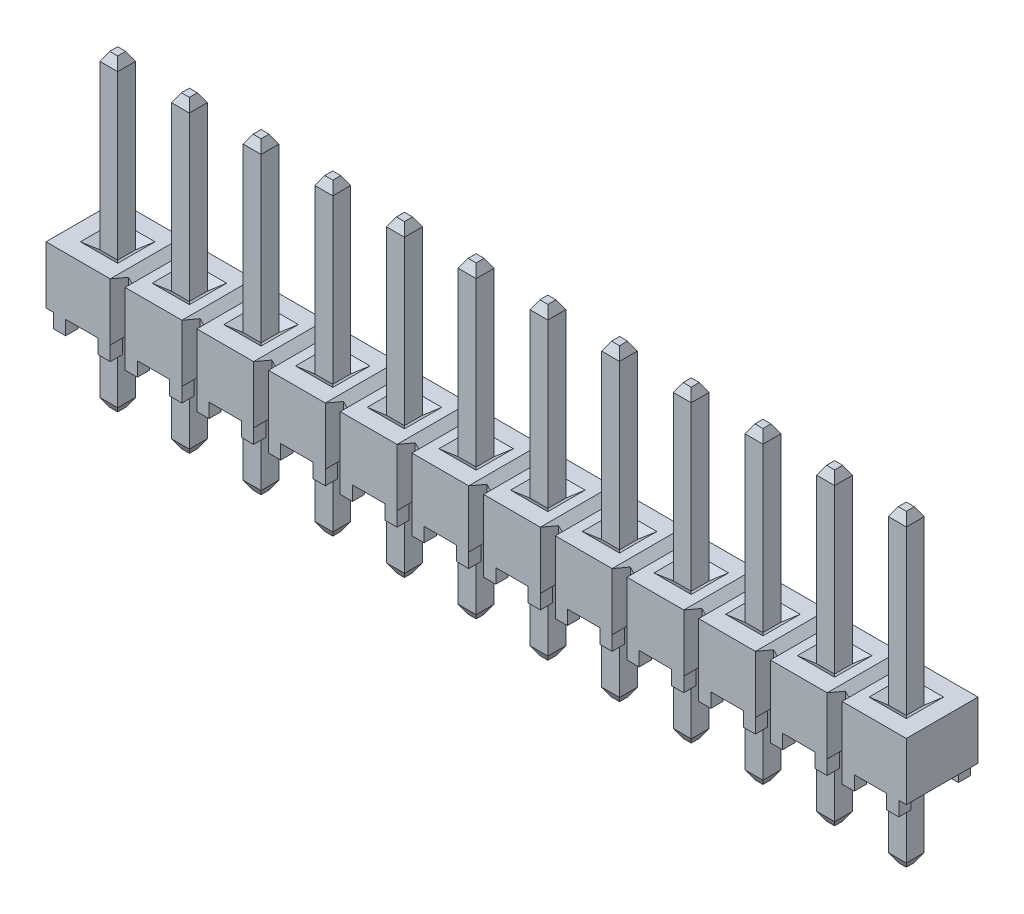
from build123d import *
from OCP.BRepFilletAPI import BRepFilletAPI_MakeChamfer

# Parameters (mm, degrees)
MAIN_BODY_DEPTH                          = 1.27
SKETCH4_W                                = 0.508
SKETCH4_H                                = 1.6764
BASE_CUT_DEPTH                           = 2.54
MAIN_BODY_PATTERN_COUNT                  = 12
MAIN_BODY_PATTERN_PITCH                  = 2.54
SKETCH19_W                               = 0.6096
SKETCH19_H                               = 0.6096
PIN_CUT_DEPTH                            = 29.083947372
PIN_CHAMFER_SIZE                         = 0.254
PIN_CHAMFER_SIZE2                        = 0.3556
PIN_PATTERN_COUNT                        = 12
PIN_PATTERN_PITCH                        = 2.54
PIN_CHAMFER_OF_PIN_PATTERN_SIZE          = 0.254
PIN_CHAMFER_OF_PIN_PATTERN_SIZE2         = 0.3556
SLOT_CUT_1_DEPTH                         = 29.083947372
SLOT_CUT_2_DEPTH                         = 2.54
SLOT_PATTERN_COUNT                       = 11
SLOT_PATTERN_PITCH                       = 2.54
SKETCH9_W                                = 0.635
SKETCH9_H                                = 10.922
STRAIGHT_LEAD_DEPTH                      = 0.3175
LEAD_CHAMFER_SIZE                        = 0.17526
LEAD_CHAMFER_SIZE2                       = 0.3048
STRAIGHT_L_PATTERN_COUNT                 = 12
STRAIGHT_L_PATTERN_PITCH                 = 2.54
LEAD_CHAMFER_OF_STRAIGHT_L_PATTERN_SIZE  = 0.17526
LEAD_CHAMFER_OF_STRAIGHT_L_PATTERN_SIZE2 = 0.3048


with BuildPart() as part:
    # Sketch3 → Main Body (new, symmetric)
    with BuildSketch(Plane.XY):
        Polygon((0, 0.508), (0.26416, 0.508), (0.26416, 0), (0.69596, 0), (0.69596, 0.508), (1.84404, 0.508), (1.84404, 0), (2.27584, 0), (2.27584, 0.508), (2.54, 0.508), (2.54, 2.54), (0, 2.54), align=None)
    main_body = extrude(amount=MAIN_BODY_DEPTH, both=True)

    # Sketch4 → Base Cut (cut)
    with BuildSketch(Plane(origin=(2.54, 2.54, 0), x_dir=(0, -1, 0), z_dir=(-1, 0, 0))):
        with Locations((2.286, 0)):
            Rectangle(SKETCH4_W, SKETCH4_H)
    base_cut = extrude(amount=BASE_CUT_DEPTH, mode=Mode.SUBTRACT)

    # Main Body Pattern: Main Body, Base Cut ×12
    with Locations(*[(-i * MAIN_BODY_PATTERN_PITCH, 0, 0) for i in range(1, MAIN_BODY_PATTERN_COUNT)]):
        add(main_body)
        add(base_cut, mode=Mode.SUBTRACT)

    # Sketch19 → Pin Cut (cut, through all)
    with BuildSketch(Plane(origin=(0, 2.54, 0), x_dir=(-1, 0, 0), z_dir=(0, 1, 0))):
        with Locations((-1.27, 0)):
            Rectangle(SKETCH19_W, SKETCH19_H)
    pin_cut = extrude(amount=-PIN_CUT_DEPTH, mode=Mode.SUBTRACT)

    # Pin Chamfer: one chamfer whose edges measure the first distance from different faces: ONE call of the kernel's chamfer builder (chamfer() names one face for all edges)
    pin_chamfer_edges_1 = [part.edges().sort_by_distance(p)[0] for p in [
        (1.27, 0.508, -0.3048),
        (1.27, 2.54, -0.3048),
    ]]
    pin_chamfer_side_1 = [part.faces().sort_by_distance(p)[0] for p in [
        (1.27, 1.524, -0.3048),
    ]]
    pin_chamfer_edges_2 = [part.edges().sort_by_distance(p)[0] for p in [
        (0.9652, 0.508, 0),
        (0.9652, 2.54, 0),
    ]]
    pin_chamfer_side_2 = [part.faces().sort_by_distance(p)[0] for p in [
        (0.9652, 1.524, 0),
    ]]
    pin_chamfer_edges_3 = [part.edges().sort_by_distance(p)[0] for p in [
        (1.27, 0.508, 0.3048),
        (1.27, 2.54, 0.3048),
    ]]
    pin_chamfer_side_3 = [part.faces().sort_by_distance(p)[0] for p in [
        (1.27, 1.524, 0.3048),
    ]]
    pin_chamfer_edges_4 = [part.edges().sort_by_distance(p)[0] for p in [
        (1.5748, 0.508, 0),
        (1.5748, 2.54, 0),
    ]]
    pin_chamfer_side_4 = [part.faces().sort_by_distance(p)[0] for p in [
        (1.5748, 1.524, 0),
    ]]
    pin_chamfer = BRepFilletAPI_MakeChamfer(part.part.solid().wrapped)
    for e in pin_chamfer_edges_1:
        pin_chamfer.Add(PIN_CHAMFER_SIZE, PIN_CHAMFER_SIZE2, e.wrapped, pin_chamfer_side_1[0].wrapped)  # the first distance lies on this face
    for e in pin_chamfer_edges_2:
        pin_chamfer.Add(PIN_CHAMFER_SIZE, PIN_CHAMFER_SIZE2, e.wrapped, pin_chamfer_side_2[0].wrapped)  # the first distance lies on this face
    for e in pin_chamfer_edges_3:
        pin_chamfer.Add(PIN_CHAMFER_SIZE, PIN_CHAMFER_SIZE2, e.wrapped, pin_chamfer_side_3[0].wrapped)  # the first distance lies on this face
    for e in pin_chamfer_edges_4:
        pin_chamfer.Add(PIN_CHAMFER_SIZE, PIN_CHAMFER_SIZE2, e.wrapped, pin_chamfer_side_4[0].wrapped)  # the first distance lies on this face
    add(Compound.cast(pin_chamfer.Shape()), mode=Mode.REPLACE)

    # Pin Pattern: Pin Cut ×12
    with Locations(*[(-i * PIN_PATTERN_PITCH, 0, 0) for i in range(1, PIN_PATTERN_COUNT)]):
        add(pin_cut, mode=Mode.SUBTRACT)

    # Pin Chamfer of Pin Pattern: one chamfer whose edges measure the first distance from different faces: ONE call of the kernel's chamfer builder (chamfer() names one face for all edges)
    pin_chamfer_of_pin_pattern_edges_1 = [part.edges().sort_by_distance(p)[0] for p in [
        (-1.27, 0.508, -0.3048),
        (-1.27, 2.54, -0.3048),
    ]]
    pin_chamfer_of_pin_pattern_side_1 = [part.faces().sort_by_distance(p)[0] for p in [
        (-1.27, 1.524, -0.3048),
    ]]
    pin_chamfer_of_pin_pattern_edges_2 = [part.edges().sort_by_distance(p)[0] for p in [
        (-1.5748, 0.508, 0),
        (-1.5748, 2.54, 0),
    ]]
    pin_chamfer_of_pin_pattern_side_2 = [part.faces().sort_by_distance(p)[0] for p in [
        (-1.5748, 1.524, 0),
    ]]
    pin_chamfer_of_pin_pattern_edges_3 = [part.edges().sort_by_distance(p)[0] for p in [
        (-1.27, 0.508, 0.3048),
        (-1.27, 2.54, 0.3048),
    ]]
    pin_chamfer_of_pin_pattern_side_3 = [part.faces().sort_by_distance(p)[0] for p in [
        (-1.27, 1.524, 0.3048),
    ]]
    pin_chamfer_of_pin_pattern_edges_4 = [part.edges().sort_by_distance(p)[0] for p in [
        (-0.9652, 0.508, 0),
        (-0.9652, 2.54, 0),
    ]]
    pin_chamfer_of_pin_pattern_side_4 = [part.faces().sort_by_distance(p)[0] for p in [
        (-0.9652, 1.524, 0),
    ]]
    pin_chamfer_of_pin_pattern_edges_5 = [part.edges().sort_by_distance(p)[0] for p in [
        (-3.81, 0.508, -0.3048),
        (-3.81, 2.54, -0.3048),
    ]]
    pin_chamfer_of_pin_pattern_side_5 = [part.faces().sort_by_distance(p)[0] for p in [
        (-3.81, 1.524, -0.3048),
    ]]
    pin_chamfer_of_pin_pattern_edges_6 = [part.edges().sort_by_distance(p)[0] for p in [
        (-4.1148, 0.508, 0),
        (-4.1148, 2.54, 0),
    ]]
    pin_chamfer_of_pin_pattern_side_6 = [part.faces().sort_by_distance(p)[0] for p in [
        (-4.1148, 1.524, 0),
    ]]
    pin_chamfer_of_pin_pattern_edges_7 = [part.edges().sort_by_distance(p)[0] for p in [
        (-3.81, 0.508, 0.3048),
        (-3.81, 2.54, 0.3048),
    ]]
    pin_chamfer_of_pin_pattern_side_7 = [part.faces().sort_by_distance(p)[0] for p in [
        (-3.81, 1.524, 0.3048),
    ]]
    pin_chamfer_of_pin_pattern_edges_8 = [part.edges().sort_by_distance(p)[0] for p in [
        (-3.5052, 0.508, 0),
        (-3.5052, 2.54, 0),
    ]]
    pin_chamfer_of_pin_pattern_side_8 = [part.faces().sort_by_distance(p)[0] for p in [
        (-3.5052, 1.524, 0),
    ]]
    pin_chamfer_of_pin_pattern_edges_9 = [part.edges().sort_by_distance(p)[0] for p in [
        (-6.35, 0.508, -0.3048),
        (-6.35, 2.54, -0.3048),
    ]]
    pin_chamfer_of_pin_pattern_side_9 = [part.faces().sort_by_distance(p)[0] for p in [
        (-6.35, 1.524, -0.3048),
    ]]
    pin_chamfer_of_pin_pattern_edges_10 = [part.edges().sort_by_distance(p)[0] for p in [
        (-6.6548, 0.508, 0),
        (-6.6548, 2.54, 0),
    ]]
    pin_chamfer_of_pin_pattern_side_10 = [part.faces().sort_by_distance(p)[0] for p in [
        (-6.6548, 1.524, 0),
    ]]
    pin_chamfer_of_pin_pattern_edges_11 = [part.edges().sort_by_distance(p)[0] for p in [
        (-6.35, 0.508, 0.3048),
        (-6.35, 2.54, 0.3048),
    ]]
    pin_chamfer_of_pin_pattern_side_11 = [part.faces().sort_by_distance(p)[0] for p in [
        (-6.35, 1.524, 0.3048),
    ]]
    pin_chamfer_of_pin_pattern_edges_12 = [part.edges().sort_by_distance(p)[0] for p in [
        (-6.0452, 0.508, 0),
        (-6.0452, 2.54, 0),
    ]]
    pin_chamfer_of_pin_pattern_side_12 = [part.faces().sort_by_distance(p)[0] for p in [
        (-6.0452, 1.524, 0),
    ]]
    pin_chamfer_of_pin_pattern_edges_13 = [part.edges().sort_by_distance(p)[0] for p in [
        (-8.89, 0.508, -0.3048),
        (-8.89, 2.54, -0.3048),
    ]]
    pin_chamfer_of_pin_pattern_side_13 = [part.faces().sort_by_distance(p)[0] for p in [
        (-8.89, 1.524, -0.3048),
    ]]
    pin_chamfer_of_pin_pattern_edges_14 = [part.edges().sort_by_distance(p)[0] for p in [
        (-9.1948, 0.508, 0),
        (-9.1948, 2.54, 0),
    ]]
    pin_chamfer_of_pin_pattern_side_14 = [part.faces().sort_by_distance(p)[0] for p in [
        (-9.1948, 1.524, 0),
    ]]
    pin_chamfer_of_pin_pattern_edges_15 = [part.edges().sort_by_distance(p)[0] for p in [
        (-8.89, 0.508, 0.3048),
        (-8.89, 2.54, 0.3048),
    ]]
    pin_chamfer_of_pin_pattern_side_15 = [part.faces().sort_by_distance(p)[0] for p in [
        (-8.89, 1.524, 0.3048),
    ]]
    pin_chamfer_of_pin_pattern_edges_16 = [part.edges().sort_by_distance(p)[0] for p in [
        (-8.5852, 0.508, 0),
        (-8.5852, 2.54, 0),
    ]]
    pin_chamfer_of_pin_pattern_side_16 = [part.faces().sort_by_distance(p)[0] for p in [
        (-8.5852, 1.524, 0),
    ]]
    pin_chamfer_of_pin_pattern_edges_17 = [part.edges().sort_by_distance(p)[0] for p in [
        (-11.43, 0.508, -0.3048),
        (-11.43, 2.54, -0.3048),
    ]]
    pin_chamfer_of_pin_pattern_side_17 = [part.faces().sort_by_distance(p)[0] for p in [
        (-11.43, 1.524, -0.3048),
    ]]
    pin_chamfer_of_pin_pattern_edges_18 = [part.edges().sort_by_distance(p)[0] for p in [
        (-11.7348, 0.508, 0),
        (-11.7348, 2.54, 0),
    ]]
    pin_chamfer_of_pin_pattern_side_18 = [part.faces().sort_by_distance(p)[0] for p in [
        (-11.7348, 1.524, 0),
    ]]
    pin_chamfer_of_pin_pattern_edges_19 = [part.edges().sort_by_distance(p)[0] for p in [
        (-11.43, 0.508, 0.3048),
        (-11.43, 2.54, 0.3048),
    ]]
    pin_chamfer_of_pin_pattern_side_19 = [part.faces().sort_by_distance(p)[0] for p in [
        (-11.43, 1.524, 0.3048),
    ]]
    pin_chamfer_of_pin_pattern_edges_20 = [part.edges().sort_by_distance(p)[0] for p in [
        (-11.1252, 0.508, 0),
        (-11.1252, 2.54, 0),
    ]]
    pin_chamfer_of_pin_pattern_side_20 = [part.faces().sort_by_distance(p)[0] for p in [
        (-11.1252, 1.524, 0),
    ]]
    pin_chamfer_of_pin_pattern_edges_21 = [part.edges().sort_by_distance(p)[0] for p in [
        (-13.97, 0.508, -0.3048),
        (-13.97, 2.54, -0.3048),
    ]]
    pin_chamfer_of_pin_pattern_side_21 = [part.faces().sort_by_distance(p)[0] for p in [
        (-13.97, 1.524, -0.3048),
    ]]
    pin_chamfer_of_pin_pattern_edges_22 = [part.edges().sort_by_distance(p)[0] for p in [
        (-14.2748, 0.508, 0),
        (-14.2748, 2.54, 0),
    ]]
    pin_chamfer_of_pin_pattern_side_22 = [part.faces().sort_by_distance(p)[0] for p in [
        (-14.2748, 1.524, 0),
    ]]
    pin_chamfer_of_pin_pattern_edges_23 = [part.edges().sort_by_distance(p)[0] for p in [
        (-13.97, 0.508, 0.3048),
        (-13.97, 2.54, 0.3048),
    ]]
    pin_chamfer_of_pin_pattern_side_23 = [part.faces().sort_by_distance(p)[0] for p in [
        (-13.97, 1.524, 0.3048),
    ]]
    pin_chamfer_of_pin_pattern_edges_24 = [part.edges().sort_by_distance(p)[0] for p in [
        (-13.6652, 0.508, 0),
        (-13.6652, 2.54, 0),
    ]]
    pin_chamfer_of_pin_pattern_side_24 = [part.faces().sort_by_distance(p)[0] for p in [
        (-13.6652, 1.524, 0),
    ]]
    pin_chamfer_of_pin_pattern_edges_25 = [part.edges().sort_by_distance(p)[0] for p in [
        (-16.51, 0.508, -0.3048),
        (-16.51, 2.54, -0.3048),
    ]]
    pin_chamfer_of_pin_pattern_side_25 = [part.faces().sort_by_distance(p)[0] for p in [
        (-16.51, 1.524, -0.3048),
    ]]
    pin_chamfer_of_pin_pattern_edges_26 = [part.edges().sort_by_distance(p)[0] for p in [
        (-16.8148, 0.508, 0),
        (-16.8148, 2.54, 0),
    ]]
    pin_chamfer_of_pin_pattern_side_26 = [part.faces().sort_by_distance(p)[0] for p in [
        (-16.8148, 1.524, 0),
    ]]
    pin_chamfer_of_pin_pattern_edges_27 = [part.edges().sort_by_distance(p)[0] for p in [
        (-16.51, 0.508, 0.3048),
        (-16.51, 2.54, 0.3048),
    ]]
    pin_chamfer_of_pin_pattern_side_27 = [part.faces().sort_by_distance(p)[0] for p in [
        (-16.51, 1.524, 0.3048),
    ]]
    pin_chamfer_of_pin_pattern_edges_28 = [part.edges().sort_by_distance(p)[0] for p in [
        (-16.2052, 0.508, 0),
        (-16.2052, 2.54, 0),
    ]]
    pin_chamfer_of_pin_pattern_side_28 = [part.faces().sort_by_distance(p)[0] for p in [
        (-16.2052, 1.524, 0),
    ]]
    pin_chamfer_of_pin_pattern_edges_29 = [part.edges().sort_by_distance(p)[0] for p in [
        (-19.05, 0.508, -0.3048),
        (-19.05, 2.54, -0.3048),
    ]]
    pin_chamfer_of_pin_pattern_side_29 = [part.faces().sort_by_distance(p)[0] for p in [
        (-19.05, 1.524, -0.3048),
    ]]
    pin_chamfer_of_pin_pattern_edges_30 = [part.edges().sort_by_distance(p)[0] for p in [
        (-19.3548, 0.508, 0),
        (-19.3548, 2.54, 0),
    ]]
    pin_chamfer_of_pin_pattern_side_30 = [part.faces().sort_by_distance(p)[0] for p in [
        (-19.3548, 1.524, 0),
    ]]
    pin_chamfer_of_pin_pattern_edges_31 = [part.edges().sort_by_distance(p)[0] for p in [
        (-19.05, 0.508, 0.3048),
        (-19.05, 2.54, 0.3048),
    ]]
    pin_chamfer_of_pin_pattern_side_31 = [part.faces().sort_by_distance(p)[0] for p in [
        (-19.05, 1.524, 0.3048),
    ]]
    pin_chamfer_of_pin_pattern_edges_32 = [part.edges().sort_by_distance(p)[0] for p in [
        (-18.7452, 0.508, 0),
        (-18.7452, 2.54, 0),
    ]]
    pin_chamfer_of_pin_pattern_side_32 = [part.faces().sort_by_distance(p)[0] for p in [
        (-18.7452, 1.524, 0),
    ]]
    pin_chamfer_of_pin_pattern_edges_33 = [part.edges().sort_by_distance(p)[0] for p in [
        (-21.59, 0.508, -0.3048),
        (-21.59, 2.54, -0.3048),
    ]]
    pin_chamfer_of_pin_pattern_side_33 = [part.faces().sort_by_distance(p)[0] for p in [
        (-21.59, 1.524, -0.3048),
    ]]
    pin_chamfer_of_pin_pattern_edges_34 = [part.edges().sort_by_distance(p)[0] for p in [
        (-21.8948, 0.508, 0),
        (-21.8948, 2.54, 0),
    ]]
    pin_chamfer_of_pin_pattern_side_34 = [part.faces().sort_by_distance(p)[0] for p in [
        (-21.8948, 1.524, 0),
    ]]
    pin_chamfer_of_pin_pattern_edges_35 = [part.edges().sort_by_distance(p)[0] for p in [
        (-21.59, 0.508, 0.3048),
        (-21.59, 2.54, 0.3048),
    ]]
    pin_chamfer_of_pin_pattern_side_35 = [part.faces().sort_by_distance(p)[0] for p in [
        (-21.59, 1.524, 0.3048),
    ]]
    pin_chamfer_of_pin_pattern_edges_36 = [part.edges().sort_by_distance(p)[0] for p in [
        (-21.2852, 0.508, 0),
        (-21.2852, 2.54, 0),
    ]]
    pin_chamfer_of_pin_pattern_side_36 = [part.faces().sort_by_distance(p)[0] for p in [
        (-21.2852, 1.524, 0),
    ]]
    pin_chamfer_of_pin_pattern_edges_37 = [part.edges().sort_by_distance(p)[0] for p in [
        (-24.13, 0.508, -0.3048),
        (-24.13, 2.54, -0.3048),
    ]]
    pin_chamfer_of_pin_pattern_side_37 = [part.faces().sort_by_distance(p)[0] for p in [
        (-24.13, 1.524, -0.3048),
    ]]
    pin_chamfer_of_pin_pattern_edges_38 = [part.edges().sort_by_distance(p)[0] for p in [
        (-24.4348, 0.508, 0),
        (-24.4348, 2.54, 0),
    ]]
    pin_chamfer_of_pin_pattern_side_38 = [part.faces().sort_by_distance(p)[0] for p in [
        (-24.4348, 1.524, 0),
    ]]
    pin_chamfer_of_pin_pattern_edges_39 = [part.edges().sort_by_distance(p)[0] for p in [
        (-24.13, 0.508, 0.3048),
        (-24.13, 2.54, 0.3048),
    ]]
    pin_chamfer_of_pin_pattern_side_39 = [part.faces().sort_by_distance(p)[0] for p in [
        (-24.13, 1.524, 0.3048),
    ]]
    pin_chamfer_of_pin_pattern_edges_40 = [part.edges().sort_by_distance(p)[0] for p in [
        (-23.8252, 0.508, 0),
        (-23.8252, 2.54, 0),
    ]]
    pin_chamfer_of_pin_pattern_side_40 = [part.faces().sort_by_distance(p)[0] for p in [
        (-23.8252, 1.524, 0),
    ]]
    pin_chamfer_of_pin_pattern_edges_41 = [part.edges().sort_by_distance(p)[0] for p in [
        (-26.67, 0.508, -0.3048),
        (-26.67, 2.54, -0.3048),
    ]]
    pin_chamfer_of_pin_pattern_side_41 = [part.faces().sort_by_distance(p)[0] for p in [
        (-26.67, 1.524, -0.3048),
    ]]
    pin_chamfer_of_pin_pattern_edges_42 = [part.edges().sort_by_distance(p)[0] for p in [
        (-26.9748, 0.508, 0),
        (-26.9748, 2.54, 0),
    ]]
    pin_chamfer_of_pin_pattern_side_42 = [part.faces().sort_by_distance(p)[0] for p in [
        (-26.9748, 1.524, 0),
    ]]
    pin_chamfer_of_pin_pattern_edges_43 = [part.edges().sort_by_distance(p)[0] for p in [
        (-26.67, 0.508, 0.3048),
        (-26.67, 2.54, 0.3048),
    ]]
    pin_chamfer_of_pin_pattern_side_43 = [part.faces().sort_by_distance(p)[0] for p in [
        (-26.67, 1.524, 0.3048),
    ]]
    pin_chamfer_of_pin_pattern_edges_44 = [part.edges().sort_by_distance(p)[0] for p in [
        (-26.3652, 0.508, 0),
        (-26.3652, 2.54, 0),
    ]]
    pin_chamfer_of_pin_pattern_side_44 = [part.faces().sort_by_distance(p)[0] for p in [
        (-26.3652, 1.524, 0),
    ]]
    pin_chamfer_of_pin_pattern = BRepFilletAPI_MakeChamfer(part.part.solid().wrapped)
    for e in pin_chamfer_of_pin_pattern_edges_1:
        pin_chamfer_of_pin_pattern.Add(PIN_CHAMFER_OF_PIN_PATTERN_SIZE, PIN_CHAMFER_OF_PIN_PATTERN_SIZE2, e.wrapped, pin_chamfer_of_pin_pattern_side_1[0].wrapped)  # the first distance lies on this face
    for e in pin_chamfer_of_pin_pattern_edges_2:
        pin_chamfer_of_pin_pattern.Add(PIN_CHAMFER_OF_PIN_PATTERN_SIZE, PIN_CHAMFER_OF_PIN_PATTERN_SIZE2, e.wrapped, pin_chamfer_of_pin_pattern_side_2[0].wrapped)  # the first distance lies on this face
    for e in pin_chamfer_of_pin_pattern_edges_3:
        pin_chamfer_of_pin_pattern.Add(PIN_CHAMFER_OF_PIN_PATTERN_SIZE, PIN_CHAMFER_OF_PIN_PATTERN_SIZE2, e.wrapped, pin_chamfer_of_pin_pattern_side_3[0].wrapped)  # the first distance lies on this face
    for e in pin_chamfer_of_pin_pattern_edges_4:
        pin_chamfer_of_pin_pattern.Add(PIN_CHAMFER_OF_PIN_PATTERN_SIZE, PIN_CHAMFER_OF_PIN_PATTERN_SIZE2, e.wrapped, pin_chamfer_of_pin_pattern_side_4[0].wrapped)  # the first distance lies on this face
    for e in pin_chamfer_of_pin_pattern_edges_5:
        pin_chamfer_of_pin_pattern.Add(PIN_CHAMFER_OF_PIN_PATTERN_SIZE, PIN_CHAMFER_OF_PIN_PATTERN_SIZE2, e.wrapped, pin_chamfer_of_pin_pattern_side_5[0].wrapped)  # the first distance lies on this face
    for e in pin_chamfer_of_pin_pattern_edges_6:
        pin_chamfer_of_pin_pattern.Add(PIN_CHAMFER_OF_PIN_PATTERN_SIZE, PIN_CHAMFER_OF_PIN_PATTERN_SIZE2, e.wrapped, pin_chamfer_of_pin_pattern_side_6[0].wrapped)  # the first distance lies on this face
    for e in pin_chamfer_of_pin_pattern_edges_7:
        pin_chamfer_of_pin_pattern.Add(PIN_CHAMFER_OF_PIN_PATTERN_SIZE, PIN_CHAMFER_OF_PIN_PATTERN_SIZE2, e.wrapped, pin_chamfer_of_pin_pattern_side_7[0].wrapped)  # the first distance lies on this face
    for e in pin_chamfer_of_pin_pattern_edges_8:
        pin_chamfer_of_pin_pattern.Add(PIN_CHAMFER_OF_PIN_PATTERN_SIZE, PIN_CHAMFER_OF_PIN_PATTERN_SIZE2, e.wrapped, pin_chamfer_of_pin_pattern_side_8[0].wrapped)  # the first distance lies on this face
    for e in pin_chamfer_of_pin_pattern_edges_9:
        pin_chamfer_of_pin_pattern.Add(PIN_CHAMFER_OF_PIN_PATTERN_SIZE, PIN_CHAMFER_OF_PIN_PATTERN_SIZE2, e.wrapped, pin_chamfer_of_pin_pattern_side_9[0].wrapped)  # the first distance lies on this face
    for e in pin_chamfer_of_pin_pattern_edges_10:
        pin_chamfer_of_pin_pattern.Add(PIN_CHAMFER_OF_PIN_PATTERN_SIZE, PIN_CHAMFER_OF_PIN_PATTERN_SIZE2, e.wrapped, pin_chamfer_of_pin_pattern_side_10[0].wrapped)  # the first distance lies on this face
    for e in pin_chamfer_of_pin_pattern_edges_11:
        pin_chamfer_of_pin_pattern.Add(PIN_CHAMFER_OF_PIN_PATTERN_SIZE, PIN_CHAMFER_OF_PIN_PATTERN_SIZE2, e.wrapped, pin_chamfer_of_pin_pattern_side_11[0].wrapped)  # the first distance lies on this face
    for e in pin_chamfer_of_pin_pattern_edges_12:
        pin_chamfer_of_pin_pattern.Add(PIN_CHAMFER_OF_PIN_PATTERN_SIZE, PIN_CHAMFER_OF_PIN_PATTERN_SIZE2, e.wrapped, pin_chamfer_of_pin_pattern_side_12[0].wrapped)  # the first distance lies on this face
    for e in pin_chamfer_of_pin_pattern_edges_13:
        pin_chamfer_of_pin_pattern.Add(PIN_CHAMFER_OF_PIN_PATTERN_SIZE, PIN_CHAMFER_OF_PIN_PATTERN_SIZE2, e.wrapped, pin_chamfer_of_pin_pattern_side_13[0].wrapped)  # the first distance lies on this face
    for e in pin_chamfer_of_pin_pattern_edges_14:
        pin_chamfer_of_pin_pattern.Add(PIN_CHAMFER_OF_PIN_PATTERN_SIZE, PIN_CHAMFER_OF_PIN_PATTERN_SIZE2, e.wrapped, pin_chamfer_of_pin_pattern_side_14[0].wrapped)  # the first distance lies on this face
    for e in pin_chamfer_of_pin_pattern_edges_15:
        pin_chamfer_of_pin_pattern.Add(PIN_CHAMFER_OF_PIN_PATTERN_SIZE, PIN_CHAMFER_OF_PIN_PATTERN_SIZE2, e.wrapped, pin_chamfer_of_pin_pattern_side_15[0].wrapped)  # the first distance lies on this face
    for e in pin_chamfer_of_pin_pattern_edges_16:
        pin_chamfer_of_pin_pattern.Add(PIN_CHAMFER_OF_PIN_PATTERN_SIZE, PIN_CHAMFER_OF_PIN_PATTERN_SIZE2, e.wrapped, pin_chamfer_of_pin_pattern_side_16[0].wrapped)  # the first distance lies on this face
    for e in pin_chamfer_of_pin_pattern_edges_17:
        pin_chamfer_of_pin_pattern.Add(PIN_CHAMFER_OF_PIN_PATTERN_SIZE, PIN_CHAMFER_OF_PIN_PATTERN_SIZE2, e.wrapped, pin_chamfer_of_pin_pattern_side_17[0].wrapped)  # the first distance lies on this face
    for e in pin_chamfer_of_pin_pattern_edges_18:
        pin_chamfer_of_pin_pattern.Add(PIN_CHAMFER_OF_PIN_PATTERN_SIZE, PIN_CHAMFER_OF_PIN_PATTERN_SIZE2, e.wrapped, pin_chamfer_of_pin_pattern_side_18[0].wrapped)  # the first distance lies on this face
    for e in pin_chamfer_of_pin_pattern_edges_19:
        pin_chamfer_of_pin_pattern.Add(PIN_CHAMFER_OF_PIN_PATTERN_SIZE, PIN_CHAMFER_OF_PIN_PATTERN_SIZE2, e.wrapped, pin_chamfer_of_pin_pattern_side_19[0].wrapped)  # the first distance lies on this face
    for e in pin_chamfer_of_pin_pattern_edges_20:
        pin_chamfer_of_pin_pattern.Add(PIN_CHAMFER_OF_PIN_PATTERN_SIZE, PIN_CHAMFER_OF_PIN_PATTERN_SIZE2, e.wrapped, pin_chamfer_of_pin_pattern_side_20[0].wrapped)  # the first distance lies on this face
    for e in pin_chamfer_of_pin_pattern_edges_21:
        pin_chamfer_of_pin_pattern.Add(PIN_CHAMFER_OF_PIN_PATTERN_SIZE, PIN_CHAMFER_OF_PIN_PATTERN_SIZE2, e.wrapped, pin_chamfer_of_pin_pattern_side_21[0].wrapped)  # the first distance lies on this face
    for e in pin_chamfer_of_pin_pattern_edges_22:
        pin_chamfer_of_pin_pattern.Add(PIN_CHAMFER_OF_PIN_PATTERN_SIZE, PIN_CHAMFER_OF_PIN_PATTERN_SIZE2, e.wrapped, pin_chamfer_of_pin_pattern_side_22[0].wrapped)  # the first distance lies on this face
    for e in pin_chamfer_of_pin_pattern_edges_23:
        pin_chamfer_of_pin_pattern.Add(PIN_CHAMFER_OF_PIN_PATTERN_SIZE, PIN_CHAMFER_OF_PIN_PATTERN_SIZE2, e.wrapped, pin_chamfer_of_pin_pattern_side_23[0].wrapped)  # the first distance lies on this face
    for e in pin_chamfer_of_pin_pattern_edges_24:
        pin_chamfer_of_pin_pattern.Add(PIN_CHAMFER_OF_PIN_PATTERN_SIZE, PIN_CHAMFER_OF_PIN_PATTERN_SIZE2, e.wrapped, pin_chamfer_of_pin_pattern_side_24[0].wrapped)  # the first distance lies on this face
    for e in pin_chamfer_of_pin_pattern_edges_25:
        pin_chamfer_of_pin_pattern.Add(PIN_CHAMFER_OF_PIN_PATTERN_SIZE, PIN_CHAMFER_OF_PIN_PATTERN_SIZE2, e.wrapped, pin_chamfer_of_pin_pattern_side_25[0].wrapped)  # the first distance lies on this face
    for e in pin_chamfer_of_pin_pattern_edges_26:
        pin_chamfer_of_pin_pattern.Add(PIN_CHAMFER_OF_PIN_PATTERN_SIZE, PIN_CHAMFER_OF_PIN_PATTERN_SIZE2, e.wrapped, pin_chamfer_of_pin_pattern_side_26[0].wrapped)  # the first distance lies on this face
    for e in pin_chamfer_of_pin_pattern_edges_27:
        pin_chamfer_of_pin_pattern.Add(PIN_CHAMFER_OF_PIN_PATTERN_SIZE, PIN_CHAMFER_OF_PIN_PATTERN_SIZE2, e.wrapped, pin_chamfer_of_pin_pattern_side_27[0].wrapped)  # the first distance lies on this face
    for e in pin_chamfer_of_pin_pattern_edges_28:
        pin_chamfer_of_pin_pattern.Add(PIN_CHAMFER_OF_PIN_PATTERN_SIZE, PIN_CHAMFER_OF_PIN_PATTERN_SIZE2, e.wrapped, pin_chamfer_of_pin_pattern_side_28[0].wrapped)  # the first distance lies on this face
    for e in pin_chamfer_of_pin_pattern_edges_29:
        pin_chamfer_of_pin_pattern.Add(PIN_CHAMFER_OF_PIN_PATTERN_SIZE, PIN_CHAMFER_OF_PIN_PATTERN_SIZE2, e.wrapped, pin_chamfer_of_pin_pattern_side_29[0].wrapped)  # the first distance lies on this face
    for e in pin_chamfer_of_pin_pattern_edges_30:
        pin_chamfer_of_pin_pattern.Add(PIN_CHAMFER_OF_PIN_PATTERN_SIZE, PIN_CHAMFER_OF_PIN_PATTERN_SIZE2, e.wrapped, pin_chamfer_of_pin_pattern_side_30[0].wrapped)  # the first distance lies on this face
    for e in pin_chamfer_of_pin_pattern_edges_31:
        pin_chamfer_of_pin_pattern.Add(PIN_CHAMFER_OF_PIN_PATTERN_SIZE, PIN_CHAMFER_OF_PIN_PATTERN_SIZE2, e.wrapped, pin_chamfer_of_pin_pattern_side_31[0].wrapped)  # the first distance lies on this face
    for e in pin_chamfer_of_pin_pattern_edges_32:
        pin_chamfer_of_pin_pattern.Add(PIN_CHAMFER_OF_PIN_PATTERN_SIZE, PIN_CHAMFER_OF_PIN_PATTERN_SIZE2, e.wrapped, pin_chamfer_of_pin_pattern_side_32[0].wrapped)  # the first distance lies on this face
    for e in pin_chamfer_of_pin_pattern_edges_33:
        pin_chamfer_of_pin_pattern.Add(PIN_CHAMFER_OF_PIN_PATTERN_SIZE, PIN_CHAMFER_OF_PIN_PATTERN_SIZE2, e.wrapped, pin_chamfer_of_pin_pattern_side_33[0].wrapped)  # the first distance lies on this face
    for e in pin_chamfer_of_pin_pattern_edges_34:
        pin_chamfer_of_pin_pattern.Add(PIN_CHAMFER_OF_PIN_PATTERN_SIZE, PIN_CHAMFER_OF_PIN_PATTERN_SIZE2, e.wrapped, pin_chamfer_of_pin_pattern_side_34[0].wrapped)  # the first distance lies on this face
    for e in pin_chamfer_of_pin_pattern_edges_35:
        pin_chamfer_of_pin_pattern.Add(PIN_CHAMFER_OF_PIN_PATTERN_SIZE, PIN_CHAMFER_OF_PIN_PATTERN_SIZE2, e.wrapped, pin_chamfer_of_pin_pattern_side_35[0].wrapped)  # the first distance lies on this face
    for e in pin_chamfer_of_pin_pattern_edges_36:
        pin_chamfer_of_pin_pattern.Add(PIN_CHAMFER_OF_PIN_PATTERN_SIZE, PIN_CHAMFER_OF_PIN_PATTERN_SIZE2, e.wrapped, pin_chamfer_of_pin_pattern_side_36[0].wrapped)  # the first distance lies on this face
    for e in pin_chamfer_of_pin_pattern_edges_37:
        pin_chamfer_of_pin_pattern.Add(PIN_CHAMFER_OF_PIN_PATTERN_SIZE, PIN_CHAMFER_OF_PIN_PATTERN_SIZE2, e.wrapped, pin_chamfer_of_pin_pattern_side_37[0].wrapped)  # the first distance lies on this face
    for e in pin_chamfer_of_pin_pattern_edges_38:
        pin_chamfer_of_pin_pattern.Add(PIN_CHAMFER_OF_PIN_PATTERN_SIZE, PIN_CHAMFER_OF_PIN_PATTERN_SIZE2, e.wrapped, pin_chamfer_of_pin_pattern_side_38[0].wrapped)  # the first distance lies on this face
    for e in pin_chamfer_of_pin_pattern_edges_39:
        pin_chamfer_of_pin_pattern.Add(PIN_CHAMFER_OF_PIN_PATTERN_SIZE, PIN_CHAMFER_OF_PIN_PATTERN_SIZE2, e.wrapped, pin_chamfer_of_pin_pattern_side_39[0].wrapped)  # the first distance lies on this face
    for e in pin_chamfer_of_pin_pattern_edges_40:
        pin_chamfer_of_pin_pattern.Add(PIN_CHAMFER_OF_PIN_PATTERN_SIZE, PIN_CHAMFER_OF_PIN_PATTERN_SIZE2, e.wrapped, pin_chamfer_of_pin_pattern_side_40[0].wrapped)  # the first distance lies on this face
    for e in pin_chamfer_of_pin_pattern_edges_41:
        pin_chamfer_of_pin_pattern.Add(PIN_CHAMFER_OF_PIN_PATTERN_SIZE, PIN_CHAMFER_OF_PIN_PATTERN_SIZE2, e.wrapped, pin_chamfer_of_pin_pattern_side_41[0].wrapped)  # the first distance lies on this face
    for e in pin_chamfer_of_pin_pattern_edges_42:
        pin_chamfer_of_pin_pattern.Add(PIN_CHAMFER_OF_PIN_PATTERN_SIZE, PIN_CHAMFER_OF_PIN_PATTERN_SIZE2, e.wrapped, pin_chamfer_of_pin_pattern_side_42[0].wrapped)  # the first distance lies on this face
    for e in pin_chamfer_of_pin_pattern_edges_43:
        pin_chamfer_of_pin_pattern.Add(PIN_CHAMFER_OF_PIN_PATTERN_SIZE, PIN_CHAMFER_OF_PIN_PATTERN_SIZE2, e.wrapped, pin_chamfer_of_pin_pattern_side_43[0].wrapped)  # the first distance lies on this face
    for e in pin_chamfer_of_pin_pattern_edges_44:
        pin_chamfer_of_pin_pattern.Add(PIN_CHAMFER_OF_PIN_PATTERN_SIZE, PIN_CHAMFER_OF_PIN_PATTERN_SIZE2, e.wrapped, pin_chamfer_of_pin_pattern_side_44[0].wrapped)  # the first distance lies on this face
    add(Compound.cast(pin_chamfer_of_pin_pattern.Shape()), mode=Mode.REPLACE)

    # Sketch5 → Slot Cut-1 (cut, through all)
    with BuildSketch(Plane(origin=(0, 0, 0), x_dir=(1, 0, 0), z_dir=(0, 1, 0))):
        Polygon((-0.26416, 1.27), (0.26416, 1.27), (0.127, 0.762), (-0.127, 0.762), align=None)
        Polygon((-0.127, -0.762), (-0.26416, -1.27), (0.26416, -1.27), (0.127, -0.762), align=None)
    slot_cut_1 = extrude(amount=SLOT_CUT_1_DEPTH, mode=Mode.SUBTRACT)

    # Sketch7 → Slot Cut-2 (cut)
    with BuildSketch(Plane.XY.offset(1.27)):
        Polygon((-0.26416, 2.54), (0, 2.27584), (0.26416, 2.54), align=None)
        Polygon((0.26416, 0.508), (-0.26416, 0.508), (0, 0.77216), align=None)
    slot_cut_2 = extrude(amount=-SLOT_CUT_2_DEPTH, mode=Mode.SUBTRACT)

    # Slot Pattern: Slot Cut-1, Slot Cut-2 ×11
    with Locations(*[(-i * SLOT_PATTERN_PITCH, 0, 0) for i in range(1, SLOT_PATTERN_COUNT)]):
        add(slot_cut_1, mode=Mode.SUBTRACT)
        add(slot_cut_2, mode=Mode.SUBTRACT)

    # Sketch9 → Straight Lead (add, symmetric)
    with BuildSketch(Plane(origin=(1.27, 0, 0), x_dir=(0, 0, -1), z_dir=(1, 0, 0))):
        with Locations((0, 2.921)):
            Rectangle(SKETCH9_W, SKETCH9_H)
    straight_lead = extrude(amount=STRAIGHT_LEAD_DEPTH, both=True)

    # Lead Chamfer: one chamfer whose edges measure the first distance from different faces: ONE call of the kernel's chamfer builder (chamfer() names one face for all edges)
    lead_chamfer_edges_1 = [part.edges().sort_by_distance(p)[0] for p in [
        (1.5875, -2.54, 0),
        (1.27, -2.54, -0.3175),
        (0.9525, -2.54, 0),
        (1.27, -2.54, 0.3175),
    ]]
    lead_chamfer_side_1 = [part.faces().sort_by_distance(p)[0] for p in [
        (1.27, -2.54, 0),
    ]]
    lead_chamfer_edges_2 = [part.edges().sort_by_distance(p)[0] for p in [
        (1.27, 8.382, 0.3175),
        (0.9525, 8.382, 0),
        (1.27, 8.382, -0.3175),
        (1.5875, 8.382, 0),
    ]]
    lead_chamfer_side_2 = [part.faces().sort_by_distance(p)[0] for p in [
        (1.27, 8.382, 0),
    ]]
    lead_chamfer = BRepFilletAPI_MakeChamfer(part.part.solid().wrapped)
    for e in lead_chamfer_edges_1:
        lead_chamfer.Add(LEAD_CHAMFER_SIZE, LEAD_CHAMFER_SIZE2, e.wrapped, lead_chamfer_side_1[0].wrapped)  # the first distance lies on this face
    for e in lead_chamfer_edges_2:
        lead_chamfer.Add(LEAD_CHAMFER_SIZE, LEAD_CHAMFER_SIZE2, e.wrapped, lead_chamfer_side_2[0].wrapped)  # the first distance lies on this face
    add(Compound.cast(lead_chamfer.Shape()), mode=Mode.REPLACE)

    # Straight L Pattern: Straight Lead ×12
    with Locations(*[(-i * STRAIGHT_L_PATTERN_PITCH, 0, 0) for i in range(1, STRAIGHT_L_PATTERN_COUNT)]):
        add(straight_lead)

    # Lead Chamfer of Straight L Pattern: one chamfer whose edges measure the first distance from different faces: ONE call of the kernel's chamfer builder (chamfer() names one face for all edges)
    lead_chamfer_of_straight_l_pattern_edges_1 = [part.edges().sort_by_distance(p)[0] for p in [
        (-0.9525, -2.54, 0),
        (-1.27, -2.54, -0.3175),
        (-1.5875, -2.54, 0),
        (-1.27, -2.54, 0.3175),
    ]]
    lead_chamfer_of_straight_l_pattern_side_1 = [part.faces().sort_by_distance(p)[0] for p in [
        (-1.27, -2.54, 0),
    ]]
    lead_chamfer_of_straight_l_pattern_edges_2 = [part.edges().sort_by_distance(p)[0] for p in [
        (-1.27, 8.382, 0.3175),
        (-1.5875, 8.382, 0),
        (-1.27, 8.382, -0.3175),
        (-0.9525, 8.382, 0),
    ]]
    lead_chamfer_of_straight_l_pattern_side_2 = [part.faces().sort_by_distance(p)[0] for p in [
        (-1.27, 8.382, 0),
    ]]
    lead_chamfer_of_straight_l_pattern_edges_3 = [part.edges().sort_by_distance(p)[0] for p in [
        (-3.4925, -2.54, 0),
        (-3.81, -2.54, -0.3175),
        (-4.1275, -2.54, 0),
        (-3.81, -2.54, 0.3175),
    ]]
    lead_chamfer_of_straight_l_pattern_side_3 = [part.faces().sort_by_distance(p)[0] for p in [
        (-3.81, -2.54, 0),
    ]]
    lead_chamfer_of_straight_l_pattern_edges_4 = [part.edges().sort_by_distance(p)[0] for p in [
        (-3.81, 8.382, 0.3175),
        (-4.1275, 8.382, 0),
        (-3.81, 8.382, -0.3175),
        (-3.4925, 8.382, 0),
    ]]
    lead_chamfer_of_straight_l_pattern_side_4 = [part.faces().sort_by_distance(p)[0] for p in [
        (-3.81, 8.382, 0),
    ]]
    lead_chamfer_of_straight_l_pattern_edges_5 = [part.edges().sort_by_distance(p)[0] for p in [
        (-6.0325, -2.54, 0),
        (-6.35, -2.54, -0.3175),
        (-6.6675, -2.54, 0),
        (-6.35, -2.54, 0.3175),
    ]]
    lead_chamfer_of_straight_l_pattern_side_5 = [part.faces().sort_by_distance(p)[0] for p in [
        (-6.35, -2.54, 0),
    ]]
    lead_chamfer_of_straight_l_pattern_edges_6 = [part.edges().sort_by_distance(p)[0] for p in [
        (-6.35, 8.382, 0.3175),
        (-6.6675, 8.382, 0),
        (-6.35, 8.382, -0.3175),
        (-6.0325, 8.382, 0),
    ]]
    lead_chamfer_of_straight_l_pattern_side_6 = [part.faces().sort_by_distance(p)[0] for p in [
        (-6.35, 8.382, 0),
    ]]
    lead_chamfer_of_straight_l_pattern_edges_7 = [part.edges().sort_by_distance(p)[0] for p in [
        (-8.5725, -2.54, 0),
        (-8.89, -2.54, -0.3175),
        (-9.2075, -2.54, 0),
        (-8.89, -2.54, 0.3175),
    ]]
    lead_chamfer_of_straight_l_pattern_side_7 = [part.faces().sort_by_distance(p)[0] for p in [
        (-8.89, -2.54, 0),
    ]]
    lead_chamfer_of_straight_l_pattern_edges_8 = [part.edges().sort_by_distance(p)[0] for p in [
        (-8.89, 8.382, 0.3175),
        (-9.2075, 8.382, 0),
        (-8.89, 8.382, -0.3175),
        (-8.5725, 8.382, 0),
    ]]
    lead_chamfer_of_straight_l_pattern_side_8 = [part.faces().sort_by_distance(p)[0] for p in [
        (-8.89, 8.382, 0),
    ]]
    lead_chamfer_of_straight_l_pattern_edges_9 = [part.edges().sort_by_distance(p)[0] for p in [
        (-11.1125, -2.54, 0),
        (-11.43, -2.54, -0.3175),
        (-11.7475, -2.54, 0),
        (-11.43, -2.54, 0.3175),
    ]]
    lead_chamfer_of_straight_l_pattern_side_9 = [part.faces().sort_by_distance(p)[0] for p in [
        (-11.43, -2.54, 0),
    ]]
    lead_chamfer_of_straight_l_pattern_edges_10 = [part.edges().sort_by_distance(p)[0] for p in [
        (-11.43, 8.382, 0.3175),
        (-11.7475, 8.382, 0),
        (-11.43, 8.382, -0.3175),
        (-11.1125, 8.382, 0),
    ]]
    lead_chamfer_of_straight_l_pattern_side_10 = [part.faces().sort_by_distance(p)[0] for p in [
        (-11.43, 8.382, 0),
    ]]
    lead_chamfer_of_straight_l_pattern_edges_11 = [part.edges().sort_by_distance(p)[0] for p in [
        (-13.6525, -2.54, 0),
        (-13.97, -2.54, -0.3175),
        (-14.2875, -2.54, 0),
        (-13.97, -2.54, 0.3175),
    ]]
    lead_chamfer_of_straight_l_pattern_side_11 = [part.faces().sort_by_distance(p)[0] for p in [
        (-13.97, -2.54, 0),
    ]]
    lead_chamfer_of_straight_l_pattern_edges_12 = [part.edges().sort_by_distance(p)[0] for p in [
        (-13.97, 8.382, 0.3175),
        (-14.2875, 8.382, 0),
        (-13.97, 8.382, -0.3175),
        (-13.6525, 8.382, 0),
    ]]
    lead_chamfer_of_straight_l_pattern_side_12 = [part.faces().sort_by_distance(p)[0] for p in [
        (-13.97, 8.382, 0),
    ]]
    lead_chamfer_of_straight_l_pattern_edges_13 = [part.edges().sort_by_distance(p)[0] for p in [
        (-16.1925, -2.54, 0),
        (-16.51, -2.54, -0.3175),
        (-16.8275, -2.54, 0),
        (-16.51, -2.54, 0.3175),
    ]]
    lead_chamfer_of_straight_l_pattern_side_13 = [part.faces().sort_by_distance(p)[0] for p in [
        (-16.51, -2.54, 0),
    ]]
    lead_chamfer_of_straight_l_pattern_edges_14 = [part.edges().sort_by_distance(p)[0] for p in [
        (-16.51, 8.382, 0.3175),
        (-16.8275, 8.382, 0),
        (-16.51, 8.382, -0.3175),
        (-16.1925, 8.382, 0),
    ]]
    lead_chamfer_of_straight_l_pattern_side_14 = [part.faces().sort_by_distance(p)[0] for p in [
        (-16.51, 8.382, 0),
    ]]
    lead_chamfer_of_straight_l_pattern_edges_15 = [part.edges().sort_by_distance(p)[0] for p in [
        (-18.7325, -2.54, 0),
        (-19.05, -2.54, -0.3175),
        (-19.3675, -2.54, 0),
        (-19.05, -2.54, 0.3175),
    ]]
    lead_chamfer_of_straight_l_pattern_side_15 = [part.faces().sort_by_distance(p)[0] for p in [
        (-19.05, -2.54, 0),
    ]]
    lead_chamfer_of_straight_l_pattern_edges_16 = [part.edges().sort_by_distance(p)[0] for p in [
        (-19.05, 8.382, 0.3175),
        (-19.3675, 8.382, 0),
        (-19.05, 8.382, -0.3175),
        (-18.7325, 8.382, 0),
    ]]
    lead_chamfer_of_straight_l_pattern_side_16 = [part.faces().sort_by_distance(p)[0] for p in [
        (-19.05, 8.382, 0),
    ]]
    lead_chamfer_of_straight_l_pattern_edges_17 = [part.edges().sort_by_distance(p)[0] for p in [
        (-21.2725, -2.54, 0),
        (-21.59, -2.54, -0.3175),
        (-21.9075, -2.54, 0),
        (-21.59, -2.54, 0.3175),
    ]]
    lead_chamfer_of_straight_l_pattern_side_17 = [part.faces().sort_by_distance(p)[0] for p in [
        (-21.59, -2.54, 0),
    ]]
    lead_chamfer_of_straight_l_pattern_edges_18 = [part.edges().sort_by_distance(p)[0] for p in [
        (-21.59, 8.382, 0.3175),
        (-21.9075, 8.382, 0),
        (-21.59, 8.382, -0.3175),
        (-21.2725, 8.382, 0),
    ]]
    lead_chamfer_of_straight_l_pattern_side_18 = [part.faces().sort_by_distance(p)[0] for p in [
        (-21.59, 8.382, 0),
    ]]
    lead_chamfer_of_straight_l_pattern_edges_19 = [part.edges().sort_by_distance(p)[0] for p in [
        (-23.8125, -2.54, 0),
        (-24.13, -2.54, -0.3175),
        (-24.4475, -2.54, 0),
        (-24.13, -2.54, 0.3175),
    ]]
    lead_chamfer_of_straight_l_pattern_side_19 = [part.faces().sort_by_distance(p)[0] for p in [
        (-24.13, -2.54, 0),
    ]]
    lead_chamfer_of_straight_l_pattern_edges_20 = [part.edges().sort_by_distance(p)[0] for p in [
        (-24.13, 8.382, 0.3175),
        (-24.4475, 8.382, 0),
        (-24.13, 8.382, -0.3175),
        (-23.8125, 8.382, 0),
    ]]
    lead_chamfer_of_straight_l_pattern_side_20 = [part.faces().sort_by_distance(p)[0] for p in [
        (-24.13, 8.382, 0),
    ]]
    lead_chamfer_of_straight_l_pattern_edges_21 = [part.edges().sort_by_distance(p)[0] for p in [
        (-26.3525, -2.54, 0),
        (-26.67, -2.54, -0.3175),
        (-26.9875, -2.54, 0),
        (-26.67, -2.54, 0.3175),
    ]]
    lead_chamfer_of_straight_l_pattern_side_21 = [part.faces().sort_by_distance(p)[0] for p in [
        (-26.67, -2.54, 0),
    ]]
    lead_chamfer_of_straight_l_pattern_edges_22 = [part.edges().sort_by_distance(p)[0] for p in [
        (-26.67, 8.382, 0.3175),
        (-26.9875, 8.382, 0),
        (-26.67, 8.382, -0.3175),
        (-26.3525, 8.382, 0),
    ]]
    lead_chamfer_of_straight_l_pattern_side_22 = [part.faces().sort_by_distance(p)[0] for p in [
        (-26.67, 8.382, 0),
    ]]
    lead_chamfer_of_straight_l_pattern = BRepFilletAPI_MakeChamfer(part.part.solid().wrapped)
    for e in lead_chamfer_of_straight_l_pattern_edges_1:
        lead_chamfer_of_straight_l_pattern.Add(LEAD_CHAMFER_OF_STRAIGHT_L_PATTERN_SIZE, LEAD_CHAMFER_OF_STRAIGHT_L_PATTERN_SIZE2, e.wrapped, lead_chamfer_of_straight_l_pattern_side_1[0].wrapped)  # the first distance lies on this face
    for e in lead_chamfer_of_straight_l_pattern_edges_2:
        lead_chamfer_of_straight_l_pattern.Add(LEAD_CHAMFER_OF_STRAIGHT_L_PATTERN_SIZE, LEAD_CHAMFER_OF_STRAIGHT_L_PATTERN_SIZE2, e.wrapped, lead_chamfer_of_straight_l_pattern_side_2[0].wrapped)  # the first distance lies on this face
    for e in lead_chamfer_of_straight_l_pattern_edges_3:
        lead_chamfer_of_straight_l_pattern.Add(LEAD_CHAMFER_OF_STRAIGHT_L_PATTERN_SIZE, LEAD_CHAMFER_OF_STRAIGHT_L_PATTERN_SIZE2, e.wrapped, lead_chamfer_of_straight_l_pattern_side_3[0].wrapped)  # the first distance lies on this face
    for e in lead_chamfer_of_straight_l_pattern_edges_4:
        lead_chamfer_of_straight_l_pattern.Add(LEAD_CHAMFER_OF_STRAIGHT_L_PATTERN_SIZE, LEAD_CHAMFER_OF_STRAIGHT_L_PATTERN_SIZE2, e.wrapped, lead_chamfer_of_straight_l_pattern_side_4[0].wrapped)  # the first distance lies on this face
    for e in lead_chamfer_of_straight_l_pattern_edges_5:
        lead_chamfer_of_straight_l_pattern.Add(LEAD_CHAMFER_OF_STRAIGHT_L_PATTERN_SIZE, LEAD_CHAMFER_OF_STRAIGHT_L_PATTERN_SIZE2, e.wrapped, lead_chamfer_of_straight_l_pattern_side_5[0].wrapped)  # the first distance lies on this face
    for e in lead_chamfer_of_straight_l_pattern_edges_6:
        lead_chamfer_of_straight_l_pattern.Add(LEAD_CHAMFER_OF_STRAIGHT_L_PATTERN_SIZE, LEAD_CHAMFER_OF_STRAIGHT_L_PATTERN_SIZE2, e.wrapped, lead_chamfer_of_straight_l_pattern_side_6[0].wrapped)  # the first distance lies on this face
    for e in lead_chamfer_of_straight_l_pattern_edges_7:
        lead_chamfer_of_straight_l_pattern.Add(LEAD_CHAMFER_OF_STRAIGHT_L_PATTERN_SIZE, LEAD_CHAMFER_OF_STRAIGHT_L_PATTERN_SIZE2, e.wrapped, lead_chamfer_of_straight_l_pattern_side_7[0].wrapped)  # the first distance lies on this face
    for e in lead_chamfer_of_straight_l_pattern_edges_8:
        lead_chamfer_of_straight_l_pattern.Add(LEAD_CHAMFER_OF_STRAIGHT_L_PATTERN_SIZE, LEAD_CHAMFER_OF_STRAIGHT_L_PATTERN_SIZE2, e.wrapped, lead_chamfer_of_straight_l_pattern_side_8[0].wrapped)  # the first distance lies on this face
    for e in lead_chamfer_of_straight_l_pattern_edges_9:
        lead_chamfer_of_straight_l_pattern.Add(LEAD_CHAMFER_OF_STRAIGHT_L_PATTERN_SIZE, LEAD_CHAMFER_OF_STRAIGHT_L_PATTERN_SIZE2, e.wrapped, lead_chamfer_of_straight_l_pattern_side_9[0].wrapped)  # the first distance lies on this face
    for e in lead_chamfer_of_straight_l_pattern_edges_10:
        lead_chamfer_of_straight_l_pattern.Add(LEAD_CHAMFER_OF_STRAIGHT_L_PATTERN_SIZE, LEAD_CHAMFER_OF_STRAIGHT_L_PATTERN_SIZE2, e.wrapped, lead_chamfer_of_straight_l_pattern_side_10[0].wrapped)  # the first distance lies on this face
    for e in lead_chamfer_of_straight_l_pattern_edges_11:
        lead_chamfer_of_straight_l_pattern.Add(LEAD_CHAMFER_OF_STRAIGHT_L_PATTERN_SIZE, LEAD_CHAMFER_OF_STRAIGHT_L_PATTERN_SIZE2, e.wrapped, lead_chamfer_of_straight_l_pattern_side_11[0].wrapped)  # the first distance lies on this face
    for e in lead_chamfer_of_straight_l_pattern_edges_12:
        lead_chamfer_of_straight_l_pattern.Add(LEAD_CHAMFER_OF_STRAIGHT_L_PATTERN_SIZE, LEAD_CHAMFER_OF_STRAIGHT_L_PATTERN_SIZE2, e.wrapped, lead_chamfer_of_straight_l_pattern_side_12[0].wrapped)  # the first distance lies on this face
    for e in lead_chamfer_of_straight_l_pattern_edges_13:
        lead_chamfer_of_straight_l_pattern.Add(LEAD_CHAMFER_OF_STRAIGHT_L_PATTERN_SIZE, LEAD_CHAMFER_OF_STRAIGHT_L_PATTERN_SIZE2, e.wrapped, lead_chamfer_of_straight_l_pattern_side_13[0].wrapped)  # the first distance lies on this face
    for e in lead_chamfer_of_straight_l_pattern_edges_14:
        lead_chamfer_of_straight_l_pattern.Add(LEAD_CHAMFER_OF_STRAIGHT_L_PATTERN_SIZE, LEAD_CHAMFER_OF_STRAIGHT_L_PATTERN_SIZE2, e.wrapped, lead_chamfer_of_straight_l_pattern_side_14[0].wrapped)  # the first distance lies on this face
    for e in lead_chamfer_of_straight_l_pattern_edges_15:
        lead_chamfer_of_straight_l_pattern.Add(LEAD_CHAMFER_OF_STRAIGHT_L_PATTERN_SIZE, LEAD_CHAMFER_OF_STRAIGHT_L_PATTERN_SIZE2, e.wrapped, lead_chamfer_of_straight_l_pattern_side_15[0].wrapped)  # the first distance lies on this face
    for e in lead_chamfer_of_straight_l_pattern_edges_16:
        lead_chamfer_of_straight_l_pattern.Add(LEAD_CHAMFER_OF_STRAIGHT_L_PATTERN_SIZE, LEAD_CHAMFER_OF_STRAIGHT_L_PATTERN_SIZE2, e.wrapped, lead_chamfer_of_straight_l_pattern_side_16[0].wrapped)  # the first distance lies on this face
    for e in lead_chamfer_of_straight_l_pattern_edges_17:
        lead_chamfer_of_straight_l_pattern.Add(LEAD_CHAMFER_OF_STRAIGHT_L_PATTERN_SIZE, LEAD_CHAMFER_OF_STRAIGHT_L_PATTERN_SIZE2, e.wrapped, lead_chamfer_of_straight_l_pattern_side_17[0].wrapped)  # the first distance lies on this face
    for e in lead_chamfer_of_straight_l_pattern_edges_18:
        lead_chamfer_of_straight_l_pattern.Add(LEAD_CHAMFER_OF_STRAIGHT_L_PATTERN_SIZE, LEAD_CHAMFER_OF_STRAIGHT_L_PATTERN_SIZE2, e.wrapped, lead_chamfer_of_straight_l_pattern_side_18[0].wrapped)  # the first distance lies on this face
    for e in lead_chamfer_of_straight_l_pattern_edges_19:
        lead_chamfer_of_straight_l_pattern.Add(LEAD_CHAMFER_OF_STRAIGHT_L_PATTERN_SIZE, LEAD_CHAMFER_OF_STRAIGHT_L_PATTERN_SIZE2, e.wrapped, lead_chamfer_of_straight_l_pattern_side_19[0].wrapped)  # the first distance lies on this face
    for e in lead_chamfer_of_straight_l_pattern_edges_20:
        lead_chamfer_of_straight_l_pattern.Add(LEAD_CHAMFER_OF_STRAIGHT_L_PATTERN_SIZE, LEAD_CHAMFER_OF_STRAIGHT_L_PATTERN_SIZE2, e.wrapped, lead_chamfer_of_straight_l_pattern_side_20[0].wrapped)  # the first distance lies on this face
    for e in lead_chamfer_of_straight_l_pattern_edges_21:
        lead_chamfer_of_straight_l_pattern.Add(LEAD_CHAMFER_OF_STRAIGHT_L_PATTERN_SIZE, LEAD_CHAMFER_OF_STRAIGHT_L_PATTERN_SIZE2, e.wrapped, lead_chamfer_of_straight_l_pattern_side_21[0].wrapped)  # the first distance lies on this face
    for e in lead_chamfer_of_straight_l_pattern_edges_22:
        lead_chamfer_of_straight_l_pattern.Add(LEAD_CHAMFER_OF_STRAIGHT_L_PATTERN_SIZE, LEAD_CHAMFER_OF_STRAIGHT_L_PATTERN_SIZE2, e.wrapped, lead_chamfer_of_straight_l_pattern_side_22[0].wrapped)  # the first distance lies on this face
    add(Compound.cast(lead_chamfer_of_straight_l_pattern.Shape()), mode=Mode.REPLACE)


solid = part.part
